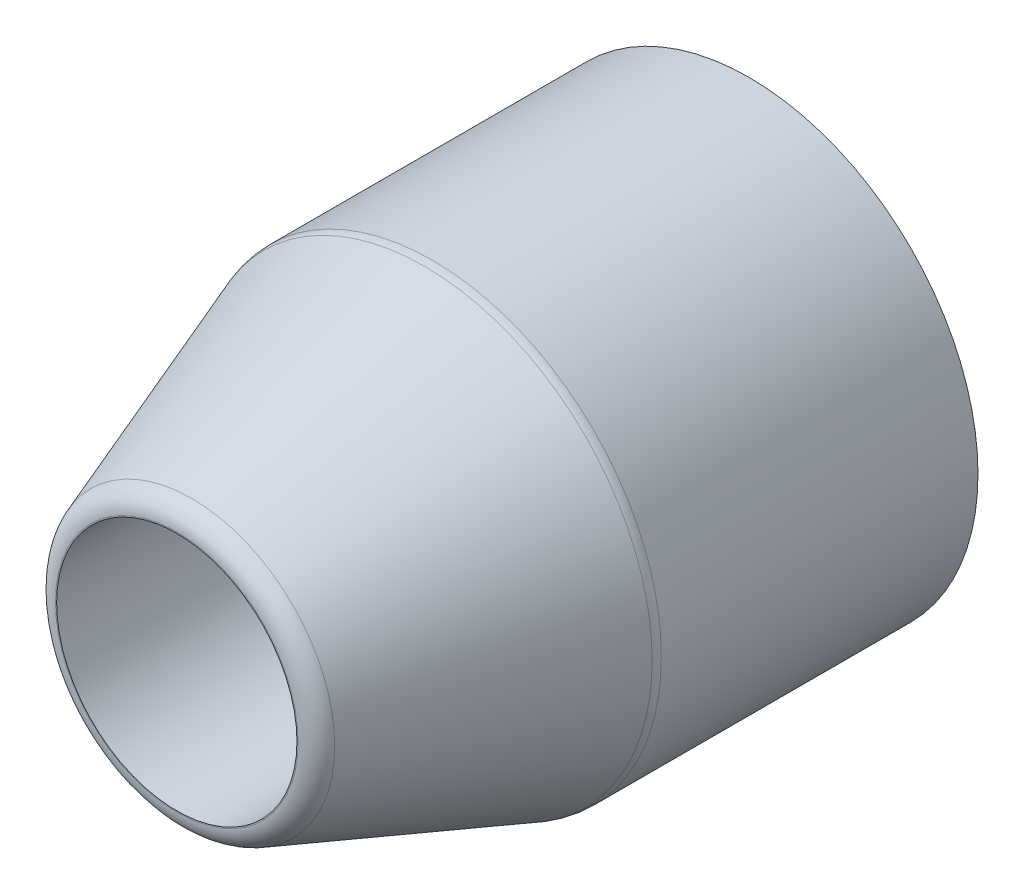
from build123d import *

# Parameters (mm, degrees)
SKETCH1_R           = 10
BOSS_EXTRUDE1_DEPTH = 25
SKETCH2_R           = 2
CUT_EXTRUDE1_DEPTH  = 29.722813233
SKETCH3_R           = 5.25
CUT_EXTRUDE2_DEPTH  = 8
CHAMFER1_SIZE       = 4
CHAMFER1_SIZE2      = 10.989909678
CHAMFER2_SIZE       = 2
FILLET1_R           = 1


with BuildPart() as part:
    # Sketch1 → Boss-Extrude1 (new body)
    with BuildSketch(Plane.XY):
        Circle(SKETCH1_R)
    extrude(amount=BOSS_EXTRUDE1_DEPTH)

    # Sketch2 → Cut-Extrude1 (cut, through all)
    with BuildSketch(Plane.XY.offset(25)):
        Circle(SKETCH2_R)
    extrude(amount=-CUT_EXTRUDE1_DEPTH, mode=Mode.SUBTRACT)

    # Sketch3 → Cut-Extrude2 (cut)
    with BuildSketch(Plane.XY.offset(25)):
        Circle(SKETCH3_R)
    extrude(amount=-CUT_EXTRUDE2_DEPTH, mode=Mode.SUBTRACT)

    # Chamfer1
    chamfer1_edges = [part.edges().sort_by_distance(p)[0] for p in [
        (-10, 0, 25),
    ]]
    chamfer1_side = [part.faces().sort_by_distance(p)[0] for p in [
        (-9.717157288, 0, 25),
    ]]
    chamfer(chamfer1_edges, length=CHAMFER1_SIZE, length2=CHAMFER1_SIZE2, reference=chamfer1_side[0])

    # Chamfer2
    chamfer2_edges = [part.edges().sort_by_distance(p)[0] for p in [
        (-2, 0, 0),
    ]]
    chamfer(chamfer2_edges, length=CHAMFER2_SIZE)

    # Fillet1
    fillet1_edges = [part.edges().sort_by_distance(p)[0] for p in [
        (-6, 0, 25),
        (-10, 0, 14.010090322),
    ]]
    fillet(fillet1_edges, radius=FILLET1_R)


solid = part.part
